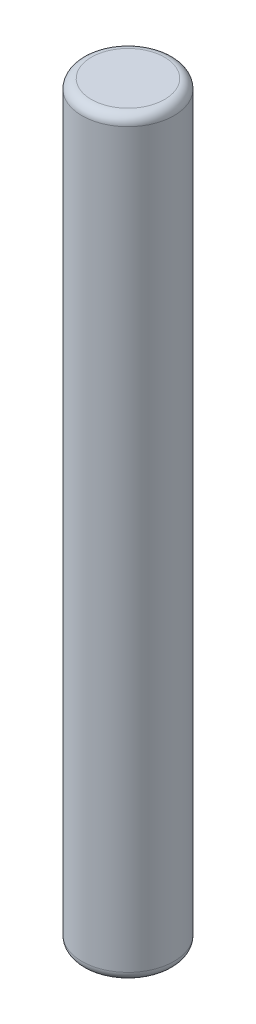
from build123d import *

# Parameters (mm, degrees)
SKETCH1_R           = 2.45
BOSS_EXTRUDE1_DEPTH = 40
FILLET1_R           = 0.5


with BuildPart() as part:
    # Sketch1 → Boss-Extrude1 (new body)
    with BuildSketch(Plane(origin=(0, 0, 0), x_dir=(1, 0, 0), z_dir=(0, 1, 0))):
        Circle(SKETCH1_R)
    extrude(amount=BOSS_EXTRUDE1_DEPTH)

    # Fillet1
    fillet1_edges = [part.edges().sort_by_distance(p)[0] for p in [
        (-2.45, 0, 0),
        (-2.45, 40, 0),
    ]]
    fillet(fillet1_edges, radius=FILLET1_R)


solid = part.part
